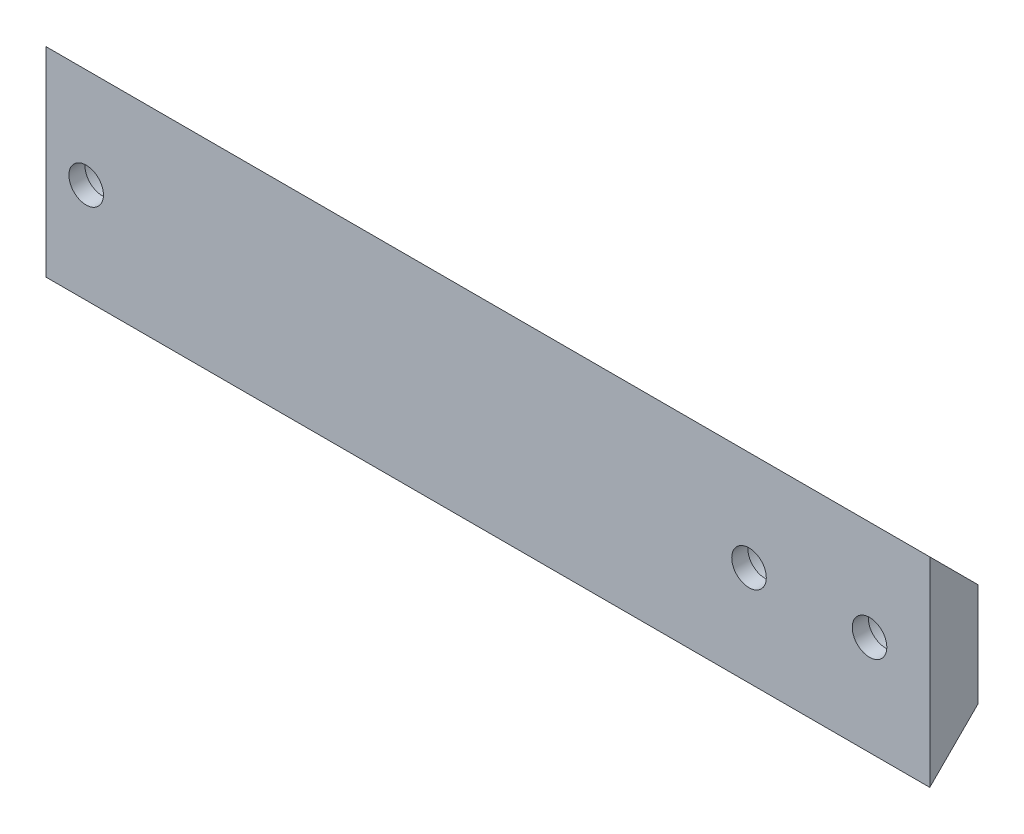
from build123d import *

# Parameters (mm, degrees)
SKETCH1_W                      = 110
SKETCH1_H                      = 24.85
BOSS_EXTRUDE1_DEPTH            = 6
CHAMFER1_SIZE                  = 6
CBORE_FOR_M4_SHCS1_D           = 4.3
CBORE_FOR_M4_SHCS1_DEPTH       = 10.1
CBORE_FOR_M4_SHCS1_CBORE_D     = 8
CBORE_FOR_M4_SHCS1_CBORE_DEPTH = 4
CBORE_FOR_M4_SHCS1_TIP         = 1.291850331


with BuildPart() as part:
    # Sketch1 → Boss-Extrude1 (new body)
    with BuildSketch(Plane.XY):
        Rectangle(SKETCH1_W, SKETCH1_H)
    extrude(amount=BOSS_EXTRUDE1_DEPTH)

    # Chamfer1
    chamfer1_edges = [part.edges().sort_by_distance(p)[0] for p in [
        (0, -12.425, 0),
        (0, 12.425, 0),
    ]]
    chamfer(chamfer1_edges, length=CHAMFER1_SIZE - 0.0001)  # a hair under: the kernel refuses the full size

    # CBORE for M4 SHCS1
    with Locations(Plane(origin=(0, 0, 0), x_dir=(-1, 0, 0), z_dir=(0, 0, -1))):
        with Locations((-47.5, 0), (-32.5, 0), (50, 0)):
            CounterBoreHole(CBORE_FOR_M4_SHCS1_D / 2, CBORE_FOR_M4_SHCS1_CBORE_D / 2, CBORE_FOR_M4_SHCS1_CBORE_DEPTH, depth=CBORE_FOR_M4_SHCS1_DEPTH)
            with Locations((0, 0, -(CBORE_FOR_M4_SHCS1_DEPTH + CBORE_FOR_M4_SHCS1_TIP / 2))):  # 118° drill point
                Cone(0, CBORE_FOR_M4_SHCS1_D / 2, CBORE_FOR_M4_SHCS1_TIP, mode=Mode.SUBTRACT)


solid = part.part
